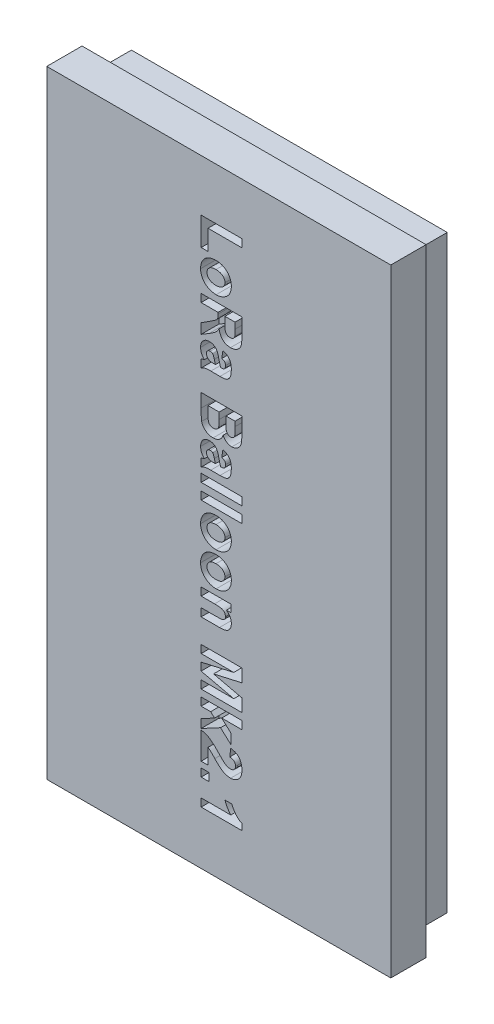
from build123d import *

# Parameters (mm, degrees)
SKETCH1_W   = 39
SKETCH1_H   = 70
BASE_DEPTH  = 4
SKETCH2_W   = 35.8
SKETCH2_H   = 66.8
SKETCH2_W_2 = 32.2
SKETCH2_H_2 = 63.2
MOUNT_DEPTH = 4
SKETCH3_W   = 0.900579279
SKETCH3_H   = 0.90057928
SKETCH3_W_2 = 4.622973633
SKETCH3_H_2 = 0.900579279
NAME_DEPTH  = 2


with BuildPart() as part:
    # Sketch1 → Base (new body)
    with BuildSketch(Plane.XY):
        with Locations((19.5, 35)):
            Rectangle(SKETCH1_W, SKETCH1_H)
    extrude(amount=BASE_DEPTH)

    # Sketch2 → Mount (add)
    with BuildSketch(Plane(origin=(0, 0, 0), x_dir=(-1, 0, 0), z_dir=(0, 0, -1))):
        with Locations((-19.5, 35)):
            Rectangle(SKETCH2_W, SKETCH2_H)
        with Locations((-19.5, 35)):
            Rectangle(SKETCH2_W_2, SKETCH2_H_2, mode=Mode.SUBTRACT)
    extrude(amount=MOUNT_DEPTH)

    # Sketch3 → Name (cut)
    # profile 1 of 16: a face of its own
    with BuildSketch(Plane.XY.offset(4)):
        with BuildLine():
            Line((17.5, 6.031366522), (17.5, 6.931945801))
            Line((17.5, 6.931945801), (20.862162642, 6.931945801))
            add(Edge.make_bspline(
                [(20.862162642, 6.931945801), (20.825420678, 6.973453861), (20.752187332, 7.056186897), (20.650809234, 7.187206769), (20.557100635, 7.322777322), (20.471558908, 7.463891787), (20.391697133, 7.608335094), (20.320234004, 7.758471363), (20.256125646, 7.91310561), (20.219928142, 8.019309163), (20.201737837, 8.072679554)],
                knots=[0, 0, 0, 0, 1.001509735, 1.996189151, 2.991510399, 3.978083136, 4.977007007, 5.972841423, 6.981293538, 8, 8, 8, 8], degree=3))
            Line((20.201737837, 8.072679554), (20.982239879, 8.072679554))
            add(Edge.make_bspline(
                [(20.982239879, 8.072679554), (21.005109125, 8.009636198), (21.052173734, 7.879893794), (21.148968325, 7.688624219), (21.269130809, 7.494509439), (21.384880743, 7.332887129), (21.488031291, 7.207004744), (21.569425456, 7.118590303), (21.654643351, 7.038363577), (21.742171402, 6.965389753), (21.83321772, 6.900070199), (21.926439738, 6.842109696), (22.022864157, 6.791460098), (22.089583646, 6.764422764), (22.122973633, 6.750891842)],
                knots=[0, 0, 0, 0, 1.342167567, 2.762163326, 4.283089962, 5.911699164, 6.739232247, 7.541374442, 8.316663201, 9.081638931, 9.82204544, 10.55892081, 11.278807199, 12, 12, 12, 12], degree=3))
            Line((22.122973633, 6.750891842), (22.122973633, 6.031366522))
            Line((22.122973633, 6.031366522), (17.5, 6.031366522))
        make_face()
    # profile 2 of 16: a face of its own
    with BuildSketch(Plane.XY.offset(4)):
        with Locations((17.950289639, 9.423548473)):
            Rectangle(SKETCH3_W, SKETCH3_H)
    # profile 3 of 16: a face of its own
    with BuildSketch(Plane.XY.offset(4)):
        with BuildLine():
            Line((18.280502042, 10.534262917), (17.5, 10.534262917))
            Line((17.5, 10.534262917), (17.5, 13.596232466))
            add(Edge.make_bspline(
                [(17.5, 13.596232466), (17.576949108, 13.585805601), (17.731103203, 13.564917198), (17.956960174, 13.50144426), (18.176976559, 13.413558777), (18.355748105, 13.319061126), (18.500491615, 13.226498924), (18.618013159, 13.142016572), (18.743992969, 13.043312165), (18.877122245, 12.928814113), (19.01967577, 12.800831624), (19.169263399, 12.656658807), (19.328268107, 12.499154665), (19.435248568, 12.387579437), (19.490655448, 12.329792855)],
                knots=[0, 0, 0, 0, 1.156489976, 2.316825642, 3.486320793, 4.683282346, 5.324698959, 6.046521303, 6.840115785, 7.709802379, 8.663715879, 9.695716306, 10.80657488, 12, 12, 12, 12], degree=3))
            add(Edge.make_bspline(
                [(19.490655448, 12.329792855), (19.534031724, 12.284677519), (19.616947467, 12.198437484), (19.736659107, 12.076728308), (19.8457136, 11.968753812), (19.942980669, 11.874007239), (20.029091873, 11.792707575), (20.105351076, 11.726417986), (20.169302387, 11.672159687), (20.210020272, 11.642893937), (20.228004733, 11.629967707)],
                knots=[0, 0, 0, 0, 1.475912402, 2.821274315, 4.025817635, 5.094889091, 6.023583783, 6.817889709, 7.477880126, 8, 8, 8, 8], degree=3))
            add(Edge.make_bspline(
                [(20.228004733, 11.629967707), (20.273808559, 11.600082147), (20.362500689, 11.542213313), (20.505070734, 11.481150256), (20.648064319, 11.442092349), (20.744350233, 11.437235769), (20.791804886, 11.434842196)],
                knots=[0, 0, 0, 0, 1.081757693, 2.094658972, 3.060949906, 4, 4, 4, 4], degree=3))
            add(Edge.make_bspline(
                [(20.791804886, 11.434842196), (20.839190464, 11.436345215), (20.929033186, 11.439194926), (21.054547391, 11.468228017), (21.162042796, 11.516383402), (21.250119658, 11.584209246), (21.318369668, 11.668283776), (21.367895285, 11.764693051), (21.397955403, 11.87335497), (21.400954099, 11.949662912), (21.40251021, 11.989261315)],
                knots=[0, 0, 0, 0, 1.215311032, 2.304221153, 3.285231831, 4.218502273, 5.131618139, 6.043921387, 6.984934089, 8, 8, 8, 8], degree=3))
            add(Edge.make_bspline(
                [(21.40251021, 11.989261315), (21.400764871, 12.032313466), (21.397439101, 12.11434999), (21.365944968, 12.229621644), (21.313665414, 12.329258262), (21.238787013, 12.412038323), (21.143533218, 12.478619319), (21.0275452, 12.527929185), (20.89161993, 12.561367794), (20.793877377, 12.57065489), (20.742085405, 12.57557595)],
                knots=[0, 0, 0, 0, 1.036204622, 1.974503585, 2.854824847, 3.725113167, 4.639232692, 5.635159131, 6.746914543, 8, 8, 8, 8], degree=3))
            Line((20.742085405, 12.57557595), (20.862162642, 13.476155229))
            add(Edge.make_bspline(
                [(20.862162642, 13.476155229), (20.914856848, 13.468924903), (21.017247203, 13.454875622), (21.164229292, 13.419446686), (21.300577042, 13.375788336), (21.426342918, 13.322550059), (21.540554019, 13.258218808), (21.644379225, 13.184749982), (21.738273215, 13.102054447), (21.819847944, 13.008347774), (21.891505772, 12.906292566), (21.953692359, 12.79596872), (22.0057178, 12.677623463), (22.049852168, 12.551778027), (22.081514616, 12.417328436), (22.106536559, 12.275228717), (22.120320981, 12.12493433), (22.122076294, 12.022120737), (22.122973633, 11.969561143)],
                knots=[0, 0, 0, 0, 1.162602182, 2.259057697, 3.301481224, 4.291058719, 5.240278367, 6.162482201, 7.068337645, 7.969664106, 8.872804886, 9.791477257, 10.734443434, 11.696874505, 12.703694303, 13.751554906, 14.850566762, 16, 16, 16, 16], degree=3))
            add(Edge.make_bspline(
                [(22.122973633, 11.969561143), (22.12216436, 11.911958212), (22.120593899, 11.80017506), (22.10070975, 11.638117668), (22.072004647, 11.486359857), (22.028214484, 11.346159334), (21.974171699, 11.215978856), (21.906051478, 11.097706108), (21.827160263, 10.989068519), (21.734640289, 10.894424656), (21.635492304, 10.810293791), (21.531834654, 10.737169245), (21.425852143, 10.673343767), (21.315019184, 10.622432795), (21.20055895, 10.583091186), (21.082762706, 10.554948562), (20.961508115, 10.537346514), (20.879421508, 10.535300855), (20.837771953, 10.534262917)],
                knots=[0, 0, 0, 0, 1.276022515, 2.476225004, 3.613980213, 4.694828494, 5.72599757, 6.731860776, 7.713356894, 8.693775576, 9.657589192, 10.592250898, 11.502803356, 12.395963178, 13.290278707, 14.181284388, 15.077210041, 16, 16, 16, 16], degree=3))
            add(Edge.make_bspline(
                [(20.837771953, 10.534262917), (20.790493163, 10.535236326), (20.696531434, 10.537170874), (20.556651025, 10.556121701), (20.418916098, 10.584936664), (20.282434953, 10.625329041), (20.14772348, 10.679930058), (20.012250121, 10.745399086), (19.877267542, 10.824863433), (19.764667283, 10.900724227), (19.671792871, 10.969915424), (19.596838962, 11.030770989), (19.518336525, 11.10098997), (19.433551797, 11.177527932), (19.344911187, 11.263130781), (19.250792263, 11.356025715), (19.152318029, 11.457407218), (19.085896671, 11.528535938), (19.05162305, 11.565238571)],
                knots=[0, 0, 0, 0, 1.065579015, 2.117728587, 3.177060151, 4.236743671, 5.322224058, 6.451217098, 7.626726301, 8.850986631, 9.510985169, 10.237811417, 11.027173618, 11.885690493, 12.813298488, 13.805522413, 14.867642961, 16, 16, 16, 16], degree=3))
            add(Edge.make_bspline(
                [(19.05162305, 11.565238571), (19.020079063, 11.599046391), (18.960015664, 11.663420389), (18.873550311, 11.754882826), (18.794668334, 11.835818348), (18.72567576, 11.908457691), (18.664320168, 11.970319157), (18.611893835, 12.023282507), (18.567294086, 12.065946194), (18.500825624, 12.127365663), (18.409279651, 12.203320651), (18.322081773, 12.25719707), (18.280502042, 12.282887684)],
                knots=[0, 0, 0, 0, 1.312344043, 2.498854831, 3.572154266, 4.519962786, 5.342095471, 6.044967059, 6.635010651, 7.093519002, 8.614063769, 10, 10, 10, 10], degree=3))
            Line((18.280502042, 12.282887684), (18.280502042, 10.534262917))
        make_face()
    # profile 4 of 16: a face of its own
    with BuildSketch(Plane.XY.offset(4)):
        Polygon((17.5, 16.838317871), (22.122973633, 16.838317871), (22.122973633, 15.937738592), (19.829310781, 15.937738592), (20.862162642, 14.999635176), (20.862162642, 13.86640625), (19.697976303, 14.922710696), (17.5, 13.746329013), (17.5, 14.715389841), (19.026294257, 15.532477916), (18.580695135, 15.937738592), (17.5, 15.937738592), align=None)
    # profile 5 of 16: a face of its own
    with BuildSketch(Plane.XY.offset(4)):
        Polygon((17.5, 22.001639071), (22.122973633, 22.001639071), (22.122973633, 20.538197743), (18.90903133, 19.810229492), (22.122973633, 19.06537538), (22.122973633, 17.618819913), (17.5, 17.618819913), (17.5, 18.519399192), (21.198941768, 18.519399192), (17.5, 19.378701921), (17.5, 20.261457235), (21.198941768, 21.101059792), (17.5, 21.101059792), align=None)
    # profile 6 of 16: a face of its own
    with BuildSketch(Plane.XY.offset(4)):
        with BuildLine():
            Line((17.5, 24.703376909), (17.5, 25.603956188))
            Line((17.5, 25.603956188), (19.218605458, 25.603956188))
            add(Edge.make_bspline(
                [(19.218605458, 25.603956188), (19.259881981, 25.604218431), (19.33868675, 25.604719103), (19.451598313, 25.606227025), (19.553850951, 25.610184029), (19.645484529, 25.614787512), (19.726240729, 25.620031047), (19.796064397, 25.627355164), (19.8548999, 25.636629558), (19.918206403, 25.649836461), (19.986420727, 25.672573643), (20.058026651, 25.710356309), (20.120869879, 25.756588033), (20.171139913, 25.813649771), (20.211805696, 25.876565918), (20.241236399, 25.944645495), (20.258624837, 26.017106197), (20.26071657, 26.066660636), (20.261776456, 26.091769964)],
                knots=[0, 0, 0, 0, 1.518468101, 2.899045743, 4.15374029, 5.282521764, 6.274203078, 7.130400985, 7.864176346, 8.464331223, 9.50833919, 10.496277288, 11.432641907, 12.361201578, 13.276990523, 14.178728215, 15.077158116, 16, 16, 16, 16], degree=3))
            add(Edge.make_bspline(
                [(20.261776456, 26.091769964), (20.260395831, 26.124432779), (20.257666872, 26.188994447), (20.234037383, 26.282658539), (20.197101841, 26.371978971), (20.144264328, 26.45430824), (20.080370598, 26.530343486), (20.001643315, 26.592223164), (19.913268019, 26.643887595), (19.829602888, 26.676153618), (19.752735925, 26.695237438), (19.683087132, 26.709741518), (19.601504403, 26.72009486), (19.508648449, 26.729871123), (19.404062142, 26.735525227), (19.288092488, 26.741809576), (19.160451233, 26.744093369), (19.071635516, 26.744485574), (19.025356154, 26.744689941)],
                knots=[0, 0, 0, 0, 0.987208667, 1.951327175, 2.905781144, 3.900987558, 4.900863378, 5.897104334, 6.91491578, 7.990576578, 8.596595857, 9.311207409, 10.142408639, 11.084155198, 12.136793968, 13.311756484, 14.59923223, 16, 16, 16, 16], degree=3))
            Line((19.025356154, 26.744689941), (17.5, 26.744689941))
            Line((17.5, 26.744689941), (17.5, 27.645269221))
            Line((17.5, 27.645269221), (20.862162642, 27.645269221))
            Line((20.862162642, 27.645269221), (20.862162642, 26.80472856))
            Line((20.862162642, 26.80472856), (20.369658349, 26.80472856))
            add(Edge.make_bspline(
                [(20.369658349, 26.80472856), (20.413616533, 26.770321373), (20.49957413, 26.703040178), (20.611985052, 26.588858325), (20.708270507, 26.468850505), (20.786728659, 26.341680594), (20.847225588, 26.20722185), (20.890517621, 26.066086122), (20.917784325, 25.918022166), (20.920714558, 25.816711582), (20.922201261, 25.765309975)],
                knots=[0, 0, 0, 0, 1.093461536, 2.13819855, 3.132977593, 4.104514142, 5.059389303, 6.015385568, 6.993072912, 8, 8, 8, 8], degree=3))
            add(Edge.make_bspline(
                [(20.922201261, 25.765309975), (20.920317919, 25.706700332), (20.91666388, 25.59298654), (20.885696808, 25.429335393), (20.832707603, 25.280159734), (20.760298213, 25.146629132), (20.672194055, 25.030041421), (20.570901367, 24.931660785), (20.456656392, 24.854076223), (20.352110831, 24.804673832), (20.260861224, 24.775259714), (20.185114665, 24.755547549), (20.101698698, 24.739757931), (20.011142966, 24.727221383), (19.913646699, 24.715475495), (19.808775892, 24.70812277), (19.696745732, 24.704905258), (19.619489692, 24.703895822), (19.579775273, 24.703376909)],
                knots=[0, 0, 0, 0, 1.428465185, 2.77149258, 4.042602701, 5.274402086, 6.460971935, 7.593531473, 8.701853732, 9.81394723, 10.399934156, 11.038034574, 11.721500487, 12.468854998, 13.267186475, 14.115831328, 15.031419898, 16, 16, 16, 16], degree=3))
            Line((19.579775273, 24.703376909), (17.5, 24.703376909))
        make_face()
    # profile 7 of 16: a face of its own
    with BuildSketch(Plane.XY.offset(4)):
        with BuildLine():
            add(Edge.make_bspline(
                [(19.227986492, 31.667856667), (19.268340591, 31.667036399), (19.348241235, 31.665412278), (19.466831788, 31.655463322), (19.582597294, 31.63605464), (19.695714536, 31.61096501), (19.806416527, 31.579441893), (19.913363069, 31.538151235), (20.018572563, 31.492044265), (20.119538873, 31.437034064), (20.216642118, 31.37772074), (20.307982668, 31.31296281), (20.392270804, 31.242988622), (20.471764649, 31.17048616), (20.542963196, 31.091302442), (20.610173753, 31.009624992), (20.668761487, 30.921545212), (20.722741328, 30.830764248), (20.769340893, 30.735441575), (20.810963092, 30.637695358), (20.84421655, 30.535984358), (20.874003462, 30.432726526), (20.895076066, 30.325606876), (20.911226693, 30.216077493), (20.920807626, 30.103272259), (20.921733394, 30.027131659), (20.922201261, 29.988651553)],
                knots=[0, 0, 0, 0, 1.087797627, 2.153826546, 3.204146119, 4.249074796, 5.276002369, 6.302929943, 7.33671768, 8.369955531, 9.399197913, 10.402506754, 11.384561342, 12.350717656, 13.299250364, 14.252266119, 15.199037181, 16.147307724, 17.097187567, 18.056740571, 19.008264324, 19.97962709, 20.951574749, 21.948063114, 22.962987564, 24, 24, 24, 24], degree=3))
            add(Edge.make_bspline(
                [(20.922201261, 29.988651553), (20.920492435, 29.924793493), (20.917163302, 29.800385279), (20.89380331, 29.618918473), (20.853287611, 29.448294563), (20.797267351, 29.287458199), (20.72326136, 29.137817172), (20.634810544, 28.997501786), (20.529143938, 28.868450261), (20.40795289, 28.752300781), (20.277240101, 28.647523356), (20.139130934, 28.556579151), (19.996080966, 28.47910388), (19.847473094, 28.415937377), (19.693540221, 28.365560189), (19.533372162, 28.331856616), (19.368435672, 28.308776132), (19.256523789, 28.306730224), (19.199843389, 28.305694025)],
                knots=[0, 0, 0, 0, 1.136040707, 2.213233445, 3.248238065, 4.25119704, 5.236487175, 6.211911138, 7.196384178, 8.195725979, 9.1931767, 10.173001403, 11.133846892, 12.083513917, 13.042376269, 14.010298635, 14.992269034, 16, 16, 16, 16], degree=3))
            add(Edge.make_bspline(
                [(19.199843389, 28.305694025), (19.157599655, 28.306375339), (19.0738988, 28.307725281), (18.949923499, 28.319708358), (18.828866965, 28.336918185), (18.710806659, 28.362715812), (18.595913097, 28.394995558), (18.484212787, 28.436018323), (18.375843769, 28.483701954), (18.270645012, 28.537857586), (18.171228883, 28.598868058), (18.076479739, 28.663312491), (17.989613644, 28.733981019), (17.908343846, 28.808413365), (17.833120613, 28.887136475), (17.764474284, 28.970880003), (17.702322369, 29.059272896), (17.647348245, 29.152054033), (17.598380596, 29.247901658), (17.556075444, 29.34662638), (17.52061437, 29.447625363), (17.49154767, 29.55076545), (17.4673821, 29.655801901), (17.452433072, 29.763820298), (17.441007522, 29.873647075), (17.440311587, 29.947656406), (17.439961381, 29.984899139)],
                knots=[0, 0, 0, 0, 1.117558833, 2.214307803, 3.293244786, 4.351421184, 5.409597582, 6.448807362, 7.497331125, 8.540978692, 9.576922014, 10.582241184, 11.570837346, 12.537122916, 13.496974449, 14.449450387, 15.399839374, 16.353464778, 17.300823134, 18.246083241, 19.193441597, 20.131138339, 21.080698472, 22.042616426, 23.015011865, 24, 24, 24, 24], degree=3))
            add(Edge.make_bspline(
                [(17.439961381, 29.984899139), (17.441434818, 30.04406421), (17.444329398, 30.160294537), (17.466190044, 30.33088657), (17.502637169, 30.493596014), (17.553836141, 30.648679353), (17.618260134, 30.796499008), (17.698440035, 30.936217507), (17.79447105, 31.067058897), (17.902499007, 31.190733435), (18.024251963, 31.303867806), (18.159878703, 31.401567068), (18.308067385, 31.483794972), (18.468125433, 31.551399101), (18.640780217, 31.603847691), (18.825794291, 31.641044136), (19.022910429, 31.66380433), (19.158504181, 31.666483685), (19.227986492, 31.667856667)],
                knots=[0, 0, 0, 0, 1.024594995, 2.012826322, 2.973358778, 3.908543225, 4.837401023, 5.761810751, 6.69243552, 7.644223827, 8.602462928, 9.564551743, 10.532007457, 11.531954493, 12.568505162, 13.651979317, 14.796803673, 16, 16, 16, 16], degree=3))
        make_face()
        with BuildLine():
            add(Edge.make_bspline(
                [(19.181081321, 30.767277388), (19.140418132, 30.7664685), (19.061457429, 30.764897782), (18.946509384, 30.755317355), (18.839622498, 30.735604285), (18.739486697, 30.712662461), (18.647961982, 30.678719777), (18.563118232, 30.640144076), (18.486368037, 30.592693862), (18.418159022, 30.538377324), (18.358227437, 30.478913691), (18.305063926, 30.416760149), (18.260023454, 30.351559232), (18.223835025, 30.282773737), (18.195763008, 30.211300883), (18.174765469, 30.136603171), (18.162389452, 30.058800558), (18.161082475, 30.005893388), (18.160424805, 29.979270519)],
                knots=[0, 0, 0, 0, 1.347985487, 2.617548842, 3.817114289, 4.948286482, 6.017057593, 7.046407217, 8.032969353, 8.999289909, 9.930051738, 10.827140183, 11.706817169, 12.550594062, 13.397420762, 14.247349517, 15.118066881, 16, 16, 16, 16], degree=3))
            add(Edge.make_bspline(
                [(18.160424805, 29.979270519), (18.161082172, 29.95327184), (18.162388524, 29.90160605), (18.174768649, 29.825667547), (18.195758212, 29.752830162), (18.224167513, 29.682614172), (18.260561859, 29.61498155), (18.306359128, 29.551083491), (18.359147439, 29.489568475), (18.42010437, 29.431777283), (18.488357165, 29.377647138), (18.565874129, 29.331881148), (18.650982245, 29.2934674), (18.743354127, 29.261692013), (18.843361939, 29.236148079), (18.951359004, 29.218739084), (19.067059726, 29.208514906), (19.146662829, 29.207035174), (19.187648045, 29.206273304)],
                knots=[0, 0, 0, 0, 0.86498205, 1.718932724, 2.552529207, 3.383717481, 4.236080589, 5.102502034, 5.995588818, 6.930639414, 7.894730959, 8.889086482, 9.918564038, 10.998334367, 12.1369617, 13.350269694, 14.635734454, 16, 16, 16, 16], degree=3))
            add(Edge.make_bspline(
                [(19.187648045, 29.206273304), (19.227688932, 29.207071515), (19.305407142, 29.208620818), (19.418448526, 29.21833585), (19.523973479, 29.237633658), (19.622320571, 29.262397561), (19.713524667, 29.294467861), (19.797316766, 29.333759882), (19.873991238, 29.380754838), (19.942107737, 29.435517195), (20.003044034, 29.494278407), (20.055828048, 29.556726541), (20.101619145, 29.621572383), (20.138009283, 29.690136473), (20.166408615, 29.761288764), (20.187393837, 29.83506114), (20.199774112, 29.911930299), (20.201080471, 29.964216902), (20.201737837, 29.99052776)],
                knots=[0, 0, 0, 0, 1.337232047, 2.595528913, 3.783536199, 4.915617704, 5.97906533, 7.006690339, 8.000659516, 8.974235141, 9.919454987, 10.823278711, 11.700968276, 12.565199868, 13.408680491, 14.254935835, 15.121875735, 16, 16, 16, 16], degree=3))
            add(Edge.make_bspline(
                [(20.201737837, 29.99052776), (20.201125638, 30.01684595), (20.199923414, 30.068529121), (20.187117275, 30.14469067), (20.1666105, 30.217653188), (20.137959369, 30.288106282), (20.10165055, 30.355793068), (20.055496899, 30.419705203), (20.003354012, 30.482079465), (19.942036507, 30.539894934), (19.873587127, 30.593986498), (19.796542842, 30.640468461), (19.712370979, 30.68027929), (19.620397249, 30.711967226), (19.521262796, 30.737162293), (19.414268616, 30.754931366), (19.300102491, 30.764983319), (19.221439565, 30.766499505), (19.181081321, 30.767277388)],
                knots=[0, 0, 0, 0, 0.8777483, 1.723705717, 2.56959874, 3.403036217, 4.257705828, 5.126471818, 6.029908573, 6.967489424, 7.934189811, 8.936630112, 9.963815147, 11.036651848, 12.178360317, 13.374360467, 14.652907978, 16, 16, 16, 16], degree=3))
        make_face(mode=Mode.SUBTRACT)
    # profile 8 of 16: a face of its own
    with BuildSketch(Plane.XY.offset(4)):
        with BuildLine():
            add(Edge.make_bspline(
                [(19.227986492, 35.510328258), (19.268340591, 35.50950799), (19.348241235, 35.507883869), (19.466831788, 35.497934913), (19.582597294, 35.478526231), (19.695714536, 35.453436601), (19.806416527, 35.421913484), (19.913363069, 35.380622826), (20.018572563, 35.334515856), (20.119538873, 35.279505655), (20.216642118, 35.22019233), (20.307982668, 35.155434401), (20.392270804, 35.085460213), (20.471764649, 35.012957751), (20.542963196, 34.933774033), (20.610173753, 34.852096583), (20.668761487, 34.764016803), (20.722741328, 34.673235839), (20.769340893, 34.577913166), (20.810963092, 34.480166949), (20.84421655, 34.378455949), (20.874003462, 34.275198117), (20.895076066, 34.168078467), (20.911226693, 34.058549084), (20.920807626, 33.945743849), (20.921733394, 33.86960325), (20.922201261, 33.831123144)],
                knots=[0, 0, 0, 0, 1.087797627, 2.153826546, 3.204146119, 4.249074796, 5.276002369, 6.302929943, 7.33671768, 8.369955531, 9.399197913, 10.402506754, 11.384561342, 12.350717656, 13.299250364, 14.252266119, 15.199037181, 16.147307724, 17.097187567, 18.056740571, 19.008264324, 19.97962709, 20.951574749, 21.948063114, 22.962987564, 24, 24, 24, 24], degree=3))
            add(Edge.make_bspline(
                [(20.922201261, 33.831123144), (20.920492435, 33.767265084), (20.917163302, 33.64285687), (20.89380331, 33.461390064), (20.853287611, 33.290766154), (20.797267351, 33.12992979), (20.72326136, 32.980288763), (20.634810544, 32.839973377), (20.529143938, 32.710921852), (20.40795289, 32.594772372), (20.277240101, 32.489994947), (20.139130934, 32.399050742), (19.996080966, 32.321575471), (19.847473094, 32.258408968), (19.693540221, 32.20803178), (19.533372162, 32.174328206), (19.368435672, 32.151247723), (19.256523789, 32.149201815), (19.199843389, 32.148165616)],
                knots=[0, 0, 0, 0, 1.136040707, 2.213233445, 3.248238065, 4.25119704, 5.236487175, 6.211911138, 7.196384178, 8.195725979, 9.1931767, 10.173001403, 11.133846892, 12.083513917, 13.042376269, 14.010298635, 14.992269034, 16, 16, 16, 16], degree=3))
            add(Edge.make_bspline(
                [(19.199843389, 32.148165616), (19.157599655, 32.14884693), (19.0738988, 32.150196872), (18.949923499, 32.162179949), (18.828866965, 32.179389776), (18.710806659, 32.205187403), (18.595913097, 32.237467149), (18.484212787, 32.278489913), (18.375843769, 32.326173545), (18.270645012, 32.380329177), (18.171228883, 32.441339649), (18.076479739, 32.505784082), (17.989613644, 32.57645261), (17.908343846, 32.650884955), (17.833120613, 32.729608066), (17.764474284, 32.813351594), (17.702322369, 32.901744487), (17.647348245, 32.994525624), (17.598380596, 33.090373249), (17.556075444, 33.189097971), (17.52061437, 33.290096954), (17.49154767, 33.393237041), (17.4673821, 33.498273492), (17.452433072, 33.606291889), (17.441007522, 33.716118666), (17.440311587, 33.790127997), (17.439961381, 33.82737073)],
                knots=[0, 0, 0, 0, 1.117558833, 2.214307803, 3.293244786, 4.351421184, 5.409597582, 6.448807362, 7.497331125, 8.540978692, 9.576922014, 10.582241184, 11.570837346, 12.537122916, 13.496974449, 14.449450387, 15.399839374, 16.353464778, 17.300823134, 18.246083241, 19.193441597, 20.131138339, 21.080698472, 22.042616426, 23.015011865, 24, 24, 24, 24], degree=3))
            add(Edge.make_bspline(
                [(17.439961381, 33.82737073), (17.441434818, 33.886535801), (17.444329398, 34.002766128), (17.466190044, 34.173358161), (17.502637169, 34.336067605), (17.553836141, 34.491150944), (17.618260134, 34.638970598), (17.698440035, 34.778689098), (17.79447105, 34.909530488), (17.902499007, 35.033205026), (18.024251963, 35.146339397), (18.159878703, 35.244038659), (18.308067385, 35.326266563), (18.468125433, 35.393870691), (18.640780217, 35.446319282), (18.825794291, 35.483515727), (19.022910429, 35.506275921), (19.158504181, 35.508955276), (19.227986492, 35.510328258)],
                knots=[0, 0, 0, 0, 1.024594995, 2.012826322, 2.973358778, 3.908543225, 4.837401023, 5.761810751, 6.69243552, 7.644223827, 8.602462928, 9.564551743, 10.532007457, 11.531954493, 12.568505162, 13.651979317, 14.796803673, 16, 16, 16, 16], degree=3))
        make_face()
        with BuildLine():
            add(Edge.make_bspline(
                [(19.181081321, 34.609748979), (19.140418132, 34.608940091), (19.061457429, 34.607369372), (18.946509384, 34.597788946), (18.839622498, 34.578075876), (18.739486697, 34.555134052), (18.647961982, 34.521191368), (18.563118232, 34.482615667), (18.486368037, 34.435165452), (18.418159022, 34.380848915), (18.358227437, 34.321385282), (18.305063926, 34.25923174), (18.260023454, 34.194030823), (18.223835025, 34.125245328), (18.195763008, 34.053772474), (18.174765469, 33.979074761), (18.162389452, 33.901272149), (18.161082475, 33.848364979), (18.160424805, 33.82174211)],
                knots=[0, 0, 0, 0, 1.347985487, 2.617548842, 3.817114289, 4.948286482, 6.017057593, 7.046407217, 8.032969353, 8.999289909, 9.930051738, 10.827140183, 11.706817169, 12.550594062, 13.397420762, 14.247349517, 15.118066881, 16, 16, 16, 16], degree=3))
            add(Edge.make_bspline(
                [(18.160424805, 33.82174211), (18.161082172, 33.795743431), (18.162388524, 33.744077641), (18.174768649, 33.668139138), (18.195758212, 33.595301753), (18.224167513, 33.525085763), (18.260561859, 33.457453141), (18.306359128, 33.393555082), (18.359147439, 33.332040066), (18.42010437, 33.274248873), (18.488357165, 33.220118729), (18.565874129, 33.174352739), (18.650982245, 33.135938991), (18.743354127, 33.104163604), (18.843361939, 33.07861967), (18.951359004, 33.061210674), (19.067059726, 33.050986497), (19.146662829, 33.049506765), (19.187648045, 33.048744895)],
                knots=[0, 0, 0, 0, 0.86498205, 1.718932724, 2.552529207, 3.383717481, 4.236080589, 5.102502034, 5.995588818, 6.930639414, 7.894730959, 8.889086482, 9.918564038, 10.998334367, 12.1369617, 13.350269694, 14.635734454, 16, 16, 16, 16], degree=3))
            add(Edge.make_bspline(
                [(19.187648045, 33.048744895), (19.227688932, 33.049543106), (19.305407142, 33.051092409), (19.418448526, 33.060807441), (19.523973479, 33.080105249), (19.622320571, 33.104869152), (19.713524667, 33.136939452), (19.797316766, 33.176231473), (19.873991238, 33.223226429), (19.942107737, 33.277988786), (20.003044034, 33.336749998), (20.055828048, 33.399198132), (20.101619145, 33.464043973), (20.138009283, 33.532608064), (20.166408615, 33.603760355), (20.187393837, 33.677532731), (20.199774112, 33.75440189), (20.201080471, 33.806688493), (20.201737837, 33.832999351)],
                knots=[0, 0, 0, 0, 1.337232047, 2.595528913, 3.783536199, 4.915617704, 5.97906533, 7.006690339, 8.000659516, 8.974235141, 9.919454987, 10.823278711, 11.700968276, 12.565199868, 13.408680491, 14.254935835, 15.121875735, 16, 16, 16, 16], degree=3))
            add(Edge.make_bspline(
                [(20.201737837, 33.832999351), (20.201125638, 33.859317541), (20.199923414, 33.911000712), (20.187117275, 33.987162261), (20.1666105, 34.060124779), (20.137959369, 34.130577873), (20.10165055, 34.198264659), (20.055496899, 34.262176794), (20.003354012, 34.324551056), (19.942036507, 34.382366525), (19.873587127, 34.436458089), (19.796542842, 34.482940052), (19.712370979, 34.522750881), (19.620397249, 34.554438817), (19.521262796, 34.579633884), (19.414268616, 34.597402957), (19.300102491, 34.60745491), (19.221439565, 34.608971096), (19.181081321, 34.609748979)],
                knots=[0, 0, 0, 0, 0.8777483, 1.723705717, 2.56959874, 3.403036217, 4.257705828, 5.126471818, 6.029908573, 6.967489424, 7.934189811, 8.936630112, 9.963815147, 11.036651848, 12.178360317, 13.374360467, 14.652907978, 16, 16, 16, 16], degree=3))
        make_face(mode=Mode.SUBTRACT)
    # profile 9 of 16: a face of its own
    with BuildSketch(Plane.XY.offset(4)):
        with Locations((19.811486817, 36.621042703)):
            Rectangle(SKETCH3_W_2, SKETCH3_H_2)
    # profile 10 of 16: a face of its own
    with BuildSketch(Plane.XY.offset(4)):
        with Locations((19.811486817, 38.362162642)):
            Rectangle(SKETCH3_W_2, SKETCH3_H)
    # profile 11 of 16: a face of its own
    with BuildSketch(Plane.XY.offset(4)):
        with BuildLine():
            Line((19.841506126, 41.514190119), (19.961583363, 42.354730779))
            add(Edge.make_bspline(
                [(19.961583363, 42.354730779), (20.003056427, 42.342822179), (20.08373433, 42.319656279), (20.198162111, 42.275938335), (20.30438426, 42.228511596), (20.401073835, 42.173704259), (20.489620864, 42.114291351), (20.568113139, 42.04778228), (20.637964286, 41.976247779), (20.699606916, 41.898815948), (20.752828321, 41.813756771), (20.798705368, 41.720744549), (20.837141958, 41.618910851), (20.867740873, 41.508588649), (20.892075182, 41.389790884), (20.909807303, 41.262288114), (20.919932697, 41.125979697), (20.921430674, 41.032334458), (20.922201261, 40.984161689)],
                knots=[0, 0, 0, 0, 1.125515524, 2.189474865, 3.193709533, 4.158305409, 5.086274303, 5.972285183, 6.837881566, 7.691743787, 8.549806887, 9.451203831, 10.393874208, 11.385866739, 12.435713252, 13.556277782, 14.742906037, 16, 16, 16, 16], degree=3))
            add(Edge.make_bspline(
                [(20.922201261, 40.984161689), (20.921986052, 40.941308612), (20.921567926, 40.858049768), (20.914195236, 40.737032314), (20.905701633, 40.623632526), (20.891648419, 40.518072692), (20.872802431, 40.420437543), (20.850656262, 40.330428478), (20.824366297, 40.248284068), (20.785361186, 40.151390147), (20.72686919, 40.044591849), (20.645227411, 39.932595052), (20.550150903, 39.841460018), (20.460504459, 39.780205056), (20.378336951, 39.742361729), (20.305144759, 39.718802341), (20.220833774, 39.698070589), (20.12519058, 39.681662166), (20.01811083, 39.668705222), (19.899799318, 39.659583899), (19.770265296, 39.653953559), (19.680158536, 39.653321832), (19.633247167, 39.652992942)],
                knots=[0, 0, 0, 0, 1.172645795, 2.278322549, 3.317437237, 4.284552983, 5.190951134, 6.037858116, 6.820064311, 7.549551753, 8.893788561, 10.141635195, 11.328036199, 12.481663495, 13.094362176, 13.79803918, 14.582676335, 15.469136844, 16.45214095, 17.533908717, 18.716103928, 20, 20, 20, 20], degree=3))
            Line((19.633247167, 39.652992942), (18.599457203, 39.660497769))
            add(Edge.make_bspline(
                [(18.599457203, 39.660497769), (18.564435728, 39.660205788), (18.496576972, 39.659640035), (18.398330909, 39.658483265), (18.307040045, 39.653276812), (18.222621106, 39.647594933), (18.144878475, 39.641908735), (18.074326469, 39.631817777), (18.010639761, 39.622171991), (17.934153527, 39.605482237), (17.841504636, 39.577679009), (17.729923806, 39.534274983), (17.614669352, 39.479704593), (17.539082625, 39.435628373), (17.5, 39.412838468)],
                knots=[0, 0, 0, 0, 1.100960395, 2.13325684, 3.08799504, 3.974623839, 4.793377983, 5.537123068, 6.214225653, 6.817686965, 7.996461938, 9.250537039, 10.578371695, 12, 12, 12, 12], degree=3))
            Line((17.5, 39.412838468), (17.5, 40.313417747))
            Line((17.5, 40.313417747), (17.867736539, 40.423175846))
            add(Edge.make_bspline(
                [(17.867736539, 40.423175846), (17.83226304, 40.45939334), (17.763238807, 40.529865237), (17.674416477, 40.644972922), (17.599695505, 40.763146591), (17.540260444, 40.886002381), (17.494849843, 41.012800628), (17.463178517, 41.143313177), (17.443827041, 41.277834702), (17.441261018, 41.368719791), (17.439961381, 41.414751157)],
                knots=[0, 0, 0, 0, 1.094238684, 2.129166538, 3.133671034, 4.10942336, 5.070833053, 6.037377746, 7.005973528, 8, 8, 8, 8], degree=3))
            add(Edge.make_bspline(
                [(17.439961381, 41.414751157), (17.441007341, 41.452615094), (17.443061457, 41.526974436), (17.454903777, 41.636008247), (17.476538098, 41.739623758), (17.507054288, 41.837634891), (17.543951561, 41.931232993), (17.591661801, 42.018833627), (17.646964549, 42.10164001), (17.71053094, 42.178636515), (17.781922723, 42.247322475), (17.857738316, 42.309714251), (17.941277911, 42.359576677), (18.028844016, 42.40317387), (18.123266364, 42.434066264), (18.222597532, 42.458105194), (18.327631273, 42.472178413), (18.399600412, 42.473921114), (18.436227209, 42.474808017)],
                knots=[0, 0, 0, 0, 1.111028414, 2.181900458, 3.212888925, 4.21115239, 5.190734394, 6.159429897, 7.131421471, 8.108723925, 9.081883785, 10.034678926, 10.981892532, 11.929727932, 12.898727489, 13.888948844, 14.925636122, 16, 16, 16, 16], degree=3))
            add(Edge.make_bspline(
                [(18.436227209, 42.474808017), (18.482593242, 42.473372815), (18.572724924, 42.470582904), (18.703283791, 42.448793498), (18.824622959, 42.412391226), (18.936022841, 42.360139981), (19.037479655, 42.295376718), (19.129142785, 42.218524625), (19.208842276, 42.128547659), (19.267148448, 42.044124803), (19.309753926, 41.96862461), (19.338835724, 41.902402774), (19.369441505, 41.829644903), (19.396985309, 41.748124366), (19.425368881, 41.659150164), (19.452494502, 41.56188663), (19.4774731, 41.456230244), (19.493569489, 41.383190178), (19.501912689, 41.345331504)],
                knots=[0, 0, 0, 0, 1.294162278, 2.515743014, 3.684113667, 4.820865117, 5.939906549, 7.036651616, 8.149715676, 9.285662014, 9.895437351, 10.567486448, 11.303637924, 12.098932185, 12.968810962, 13.91153998, 14.917493754, 16, 16, 16, 16], degree=3))
            add(Edge.make_bspline(
                [(19.501912689, 41.345331504), (19.511407002, 41.29963326), (19.529650374, 41.211823847), (19.559131352, 41.085951379), (19.587017816, 40.970804952), (19.61413993, 40.866238728), (19.640930358, 40.772559678), (19.668501435, 40.689876759), (19.694085633, 40.617635872), (19.712787099, 40.57381943), (19.721428888, 40.553572221)],
                knots=[0, 0, 0, 0, 1.361164628, 2.615484881, 3.770095419, 4.816364149, 5.765912261, 6.610903979, 7.358110453, 8, 8, 8, 8], degree=3))
            add(Edge.make_bspline(
                [(19.721428888, 40.553572221), (19.76207844, 40.554231496), (19.835936364, 40.55542936), (19.93546068, 40.560763475), (20.012171286, 40.572303879), (20.070146149, 40.58844442), (20.113156329, 40.61503175), (20.150196809, 40.646884119), (20.18179134, 40.688294767), (20.210776693, 40.737003838), (20.234039299, 40.795757876), (20.250744994, 40.864838443), (20.259418855, 40.94454444), (20.260957962, 41.001028678), (20.261776456, 41.03106686)],
                knots=[0, 0, 0, 0, 1.704637254, 3.09722893, 4.172654963, 4.956246112, 5.596985007, 6.275246559, 6.99385986, 7.769515704, 8.645866914, 9.631493719, 10.740434052, 12, 12, 12, 12], degree=3))
            add(Edge.make_bspline(
                [(20.261776456, 41.03106686), (20.260884607, 41.061819135), (20.25919465, 41.120091345), (20.241526382, 41.202176529), (20.215410217, 41.274928832), (20.174002857, 41.337526849), (20.117664666, 41.392371274), (20.042764104, 41.439724199), (19.949087652, 41.481595463), (19.879011929, 41.502826748), (19.841506126, 41.514190119)],
                knots=[0, 0, 0, 0, 1.045871977, 1.981813381, 2.848317391, 3.663751395, 4.514929533, 5.507645304, 6.666046366, 8, 8, 8, 8], degree=3))
        make_face()
        with BuildLine():
            add(Edge.make_bspline(
                [(19.121042702, 40.553572221), (19.111478433, 40.581029413), (19.090198568, 40.642119846), (19.059474829, 40.744742381), (19.027018533, 40.867855942), (19.005193715, 40.956919288), (18.993460638, 41.004799964)],
                knots=[0, 0, 0, 0, 0.743632693, 1.654533494, 2.73907137, 4, 4, 4, 4], degree=3))
            add(Edge.make_bspline(
                [(18.993460638, 41.004799964), (18.98653897, 41.033017956), (18.97332241, 41.08689873), (18.950053418, 41.163232813), (18.928514853, 41.232519981), (18.904326783, 41.293793407), (18.881777826, 41.348222317), (18.857166421, 41.394601166), (18.832210074, 41.433424727), (18.813567384, 41.455259472), (18.804901851, 41.465408741)],
                knots=[0, 0, 0, 0, 1.388607462, 2.65147299, 3.814389992, 4.855436495, 5.799565367, 6.62877246, 7.362623276, 8, 8, 8, 8], degree=3))
            add(Edge.make_bspline(
                [(18.804901851, 41.465408741), (18.787150786, 41.482293284), (18.752087496, 41.515644953), (18.686643373, 41.549529351), (18.614581201, 41.571002361), (18.563658271, 41.573135007), (18.537542378, 41.574228738)],
                knots=[0, 0, 0, 0, 0.985740837, 1.947112291, 2.947173789, 4, 4, 4, 4], degree=3))
            add(Edge.make_bspline(
                [(18.537542378, 41.574228738), (18.50766342, 41.572939924), (18.449801672, 41.570444088), (18.366786442, 41.546484186), (18.290760217, 41.50914416), (18.224593068, 41.455951695), (18.168585191, 41.393231307), (18.129814521, 41.31928554), (18.103890852, 41.238862588), (18.101569181, 41.18199624), (18.100386186, 41.153020304)],
                knots=[0, 0, 0, 0, 1.056198986, 2.045369905, 3.036276429, 4.038084886, 5.035473036, 5.992159802, 6.976916006, 8, 8, 8, 8], degree=3))
            add(Edge.make_bspline(
                [(18.100386186, 41.153020304), (18.101736527, 41.126025569), (18.104453435, 41.071711719), (18.124157539, 40.990656531), (18.156784545, 40.910533962), (18.200051148, 40.832286446), (18.252073425, 40.760421569), (18.311090427, 40.699433639), (18.374225547, 40.649895191), (18.432190619, 40.617965881), (18.484079963, 40.599086358), (18.530121172, 40.587625835), (18.5827991, 40.575734161), (18.642798398, 40.568047983), (18.709733915, 40.561359924), (18.78390109, 40.556870895), (18.865230729, 40.554055933), (18.921849407, 40.553737535), (18.951245984, 40.553572221)],
                knots=[0, 0, 0, 0, 1.093500888, 2.200141778, 3.360346716, 4.591280596, 5.815607582, 6.94487563, 8.019710678, 9.057444999, 9.610729159, 10.253199895, 10.979011171, 11.798077413, 12.702238226, 13.705425431, 14.808650418, 16, 16, 16, 16], degree=3))
            Line((18.951245984, 40.553572221), (19.121042702, 40.553572221))
        make_face(mode=Mode.SUBTRACT)
    # profile 12 of 16: a face of its own
    with BuildSketch(Plane.XY.offset(4)):
        with BuildLine():
            Line((22.122973633, 46.737549938), (22.122973633, 44.910124484))
            add(Edge.make_bspline(
                [(22.122973633, 44.910124484), (22.122521051, 44.850084862), (22.121651102, 44.734677139), (22.117632998, 44.568221255), (22.108005759, 44.415905539), (22.095757541, 44.277353061), (22.081840746, 44.152540778), (22.061533426, 44.041599191), (22.040180572, 43.944097754), (22.0049456, 43.833595711), (21.948462842, 43.709246881), (21.859088002, 43.573885608), (21.748544411, 43.450302277), (21.640427701, 43.359753677), (21.545807025, 43.29495681), (21.471963858, 43.251349674), (21.394724771, 43.215890036), (21.315529677, 43.187009152), (21.2346417, 43.162652812), (21.150572045, 43.147614693), (21.064475175, 43.136283422), (21.006044505, 43.135584759), (20.976611259, 43.135232821)],
                knots=[0, 0, 0, 0, 1.498327689, 2.88007457, 4.154414764, 5.305986542, 6.351317343, 7.286582663, 8.11946184, 8.840080679, 10.177555878, 11.512935148, 12.872513647, 14.301275782, 15.019863751, 15.733221227, 16.438466007, 17.137161526, 17.836031326, 18.543086972, 19.26611006, 20, 20, 20, 20], degree=3))
            add(Edge.make_bspline(
                [(20.976611259, 43.135232821), (20.922946761, 43.137303044), (20.817024149, 43.141389234), (20.662821857, 43.176710702), (20.51596526, 43.232138074), (20.380113254, 43.311328688), (20.256588311, 43.407542998), (20.148778926, 43.518348036), (20.056681459, 43.641777128), (20.011500867, 43.733566768), (19.988788362, 43.779709868)],
                knots=[0, 0, 0, 0, 1.031817477, 2.036594177, 3.029254201, 4.043130586, 5.050931669, 6.034203586, 7.01178454, 8, 8, 8, 8], degree=3))
            add(Edge.make_bspline(
                [(19.988788362, 43.779709868), (19.978291223, 43.748276354), (19.957542489, 43.686144606), (19.919057509, 43.596987521), (19.874445181, 43.513373813), (19.826159834, 43.433822513), (19.770442173, 43.360917896), (19.709973461, 43.293161392), (19.645321829, 43.229379638), (19.573797837, 43.173095387), (19.499063042, 43.120637644), (19.418797393, 43.076896374), (19.335071516, 43.039243904), (19.247401209, 43.00781132), (19.155229507, 42.984808535), (19.059306459, 42.967942303), (18.959608937, 42.957391697), (18.891858621, 42.95588334), (18.857435643, 42.955116966)],
                knots=[0, 0, 0, 0, 1.053917501, 2.08318216, 3.084375989, 4.067115349, 5.039987852, 5.998256831, 6.954975631, 7.924383767, 8.890110205, 9.856297623, 10.826929889, 11.808561028, 12.814635272, 13.844956918, 14.905053061, 16, 16, 16, 16], degree=3))
            add(Edge.make_bspline(
                [(18.857435643, 42.955116966), (18.815500063, 42.956062077), (18.733295748, 42.957914735), (18.612472135, 42.971178049), (18.496620731, 42.993557639), (18.385911071, 43.025581587), (18.279951486, 43.065972101), (18.179119697, 43.115922872), (18.083315073, 43.175373566), (17.992730779, 43.242648072), (17.90919217, 43.316006825), (17.833589227, 43.393712653), (17.765489185, 43.473928008), (17.707581308, 43.559131829), (17.656528591, 43.646316505), (17.61374927, 43.736794735), (17.581005615, 43.831050671), (17.565164633, 43.895583163), (17.557224308, 43.927930208)],
                knots=[0, 0, 0, 0, 1.145607172, 2.24567906, 3.316329682, 4.365460088, 5.390414304, 6.410550385, 7.434792233, 8.46684308, 9.489944109, 10.468671886, 11.426900475, 12.36059261, 13.279351643, 14.185149476, 15.09030244, 16, 16, 16, 16], degree=3))
            add(Edge.make_bspline(
                [(17.557224308, 43.927930208), (17.552629506, 43.954476266), (17.542179673, 44.014849236), (17.530238938, 44.117507113), (17.521967062, 44.242764847), (17.512784829, 44.390627107), (17.508239794, 44.561140115), (17.503113461, 44.754373132), (17.500511164, 44.970156543), (17.500175925, 45.12151011), (17.5, 45.200936543)],
                knots=[0, 0, 0, 0, 0.506837559, 1.152686718, 1.943271314, 2.868501158, 3.939884368, 5.152247396, 6.505573166, 8, 8, 8, 8], degree=3))
            Line((17.5, 45.200936543), (17.5, 46.737549938))
            Line((17.5, 46.737549938), (22.122973633, 46.737549938))
        make_face()
        with BuildLine():
            Line((21.342471591, 45.836970659), (20.321815075, 45.836970659))
            Line((20.321815075, 45.836970659), (20.321815075, 45.223451025))
            add(Edge.make_bspline(
                [(20.321815075, 45.223451025), (20.321708304, 45.179672293), (20.321505436, 45.096491461), (20.322860414, 44.97829506), (20.323271951, 44.873214079), (20.325612076, 44.7812947), (20.326868369, 44.702771579), (20.330184865, 44.637450258), (20.332255296, 44.585143819), (20.33545221, 44.554574189), (20.336824729, 44.541449842)],
                knots=[0, 0, 0, 0, 1.539755574, 2.925579234, 4.157432792, 5.235486124, 6.159601295, 6.919197766, 7.535983151, 8, 8, 8, 8], degree=3))
            add(Edge.make_bspline(
                [(20.336824729, 44.541449842), (20.342990913, 44.503699738), (20.354742688, 44.431753986), (20.388025395, 44.330904457), (20.433788831, 44.243241231), (20.491801151, 44.16799627), (20.562445267, 44.108032512), (20.646094328, 44.066032847), (20.740542137, 44.040045927), (20.807575483, 44.037261325), (20.84246247, 44.0358121)],
                knots=[0, 0, 0, 0, 1.156043088, 2.203236031, 3.197816213, 4.134692963, 5.061434266, 5.975433912, 6.946330216, 8, 8, 8, 8], degree=3))
            add(Edge.make_bspline(
                [(20.84246247, 44.0358121), (20.873876263, 44.036823866), (20.934019538, 44.038760942), (21.019351721, 44.060444709), (21.096016804, 44.093937475), (21.161935885, 44.14262246), (21.216357618, 44.200808188), (21.262093272, 44.264229102), (21.293723027, 44.334602435), (21.3117268, 44.399634222), (21.321477076, 44.463035926), (21.325841476, 44.52924141), (21.332380205, 44.613587703), (21.334869957, 44.715945723), (21.339580253, 44.836603876), (21.340377663, 44.975171632), (21.343094236, 45.131820783), (21.342686451, 45.242211346), (21.342471591, 45.300375505)],
                knots=[0, 0, 0, 0, 0.973031789, 1.862917975, 2.714444411, 3.555113712, 4.385861934, 5.180259999, 5.970734499, 6.766732084, 7.267820327, 7.959442945, 8.825288207, 9.893716152, 11.136763095, 12.573466007, 14.194578749, 16, 16, 16, 16], degree=3))
            Line((21.342471591, 45.300375505), (21.342471591, 45.836970659))
        make_face(mode=Mode.SUBTRACT)
        with BuildLine():
            Line((19.541313033, 45.836970659), (18.280502042, 45.836970659))
            Line((18.280502042, 45.836970659), (18.280502042, 44.996429998))
            add(Edge.make_bspline(
                [(18.280502042, 44.996429998), (18.280760428, 44.952339078), (18.281253401, 44.868218478), (18.282800025, 44.748429793), (18.286518536, 44.641150033), (18.291887116, 44.546029751), (18.299557696, 44.463184684), (18.307251331, 44.392614738), (18.317857629, 44.334782943), (18.331738252, 44.274037716), (18.35944942, 44.209130231), (18.402845831, 44.13923486), (18.458232543, 44.075216926), (18.525607831, 44.019335274), (18.604204685, 43.972817602), (18.693207476, 43.938929753), (18.79246554, 43.919124447), (18.861720576, 43.916895324), (18.897774089, 43.915734863)],
                knots=[0, 0, 0, 0, 1.468823539, 2.802352852, 3.990613231, 5.044577628, 5.97542194, 6.762296442, 7.407977832, 7.933490854, 8.834961323, 9.742609811, 10.665728169, 11.642033707, 12.646065455, 13.694610711, 14.799836276, 16, 16, 16, 16], degree=3))
            add(Edge.make_bspline(
                [(18.897774089, 43.915734863), (18.93476601, 43.917230815), (19.005924698, 43.92010847), (19.107872413, 43.940522207), (19.199388257, 43.976442803), (19.279963622, 44.026964865), (19.349625379, 44.088966591), (19.407243483, 44.161368569), (19.454309014, 44.242268996), (19.482516024, 44.31872795), (19.49973763, 44.38934175), (19.510234486, 44.455291191), (19.521102124, 44.533072283), (19.527554048, 44.623651319), (19.534829997, 44.726159136), (19.5376358, 44.84132482), (19.540957195, 44.968580629), (19.541190876, 45.057716133), (19.541313033, 45.104311891)],
                knots=[0, 0, 0, 0, 1.143215143, 2.19912046, 3.197116365, 4.165365694, 5.123819291, 6.065802965, 7.014162653, 8.005206416, 8.5725482, 9.259043701, 10.068343003, 10.999502645, 12.064921609, 13.244816419, 14.559722402, 16, 16, 16, 16], degree=3))
            Line((19.541313033, 45.104311891), (19.541313033, 45.836970659))
        make_face(mode=Mode.SUBTRACT)
    # profile 13 of 16: a face of its own
    with BuildSketch(Plane.XY.offset(4)):
        with BuildLine():
            Line((19.841506126, 51.240446333), (19.961583363, 52.080986994))
            add(Edge.make_bspline(
                [(19.961583363, 52.080986994), (20.003056427, 52.069078394), (20.08373433, 52.045912494), (20.198162111, 52.002194549), (20.30438426, 51.95476781), (20.401073835, 51.899960474), (20.489620864, 51.840547565), (20.568113139, 51.774038494), (20.637964286, 51.702503993), (20.699606916, 51.625072163), (20.752828321, 51.540012986), (20.798705368, 51.447000764), (20.837141958, 51.345167065), (20.867740873, 51.234844863), (20.892075182, 51.116047099), (20.909807303, 50.988544328), (20.919932697, 50.852235912), (20.921430674, 50.758590672), (20.922201261, 50.710417904)],
                knots=[0, 0, 0, 0, 1.125515524, 2.189474865, 3.193709533, 4.158305409, 5.086274303, 5.972285183, 6.837881566, 7.691743787, 8.549806887, 9.451203831, 10.393874208, 11.385866739, 12.435713252, 13.556277782, 14.742906037, 16, 16, 16, 16], degree=3))
            add(Edge.make_bspline(
                [(20.922201261, 50.710417904), (20.921986052, 50.667564826), (20.921567926, 50.584305983), (20.914195236, 50.463288529), (20.905701633, 50.34988874), (20.891648419, 50.244328906), (20.872802431, 50.146693758), (20.850656262, 50.056684693), (20.824366297, 49.974540283), (20.785361186, 49.877646362), (20.72686919, 49.770848064), (20.645227411, 49.658851266), (20.550150903, 49.567716233), (20.460504459, 49.50646127), (20.378336951, 49.468617943), (20.305144759, 49.445058555), (20.220833774, 49.424326803), (20.12519058, 49.407918381), (20.01811083, 49.394961437), (19.899799318, 49.385840114), (19.770265296, 49.380209773), (19.680158536, 49.379578046), (19.633247167, 49.379249157)],
                knots=[0, 0, 0, 0, 1.172645795, 2.278322549, 3.317437237, 4.284552983, 5.190951134, 6.037858116, 6.820064311, 7.549551753, 8.893788561, 10.141635195, 11.328036199, 12.481663495, 13.094362176, 13.79803918, 14.582676335, 15.469136844, 16.45214095, 17.533908717, 18.716103928, 20, 20, 20, 20], degree=3))
            Line((19.633247167, 49.379249157), (18.599457203, 49.386753984))
            add(Edge.make_bspline(
                [(18.599457203, 49.386753984), (18.564435728, 49.386462002), (18.496576972, 49.385896249), (18.398330909, 49.384739479), (18.307040045, 49.379533026), (18.222621106, 49.373851148), (18.144878475, 49.36816495), (18.074326469, 49.358073992), (18.010639761, 49.348428206), (17.934153527, 49.331738451), (17.841504636, 49.303935223), (17.729923806, 49.260531198), (17.614669352, 49.205960808), (17.539082625, 49.161884588), (17.5, 49.139094682)],
                knots=[0, 0, 0, 0, 1.100960395, 2.13325684, 3.08799504, 3.974623839, 4.793377983, 5.537123068, 6.214225653, 6.817686965, 7.996461938, 9.250537039, 10.578371695, 12, 12, 12, 12], degree=3))
            Line((17.5, 49.139094682), (17.5, 50.039673961))
            Line((17.5, 50.039673961), (17.867736539, 50.149432061))
            add(Edge.make_bspline(
                [(17.867736539, 50.149432061), (17.83226304, 50.185649555), (17.763238807, 50.256121451), (17.674416477, 50.371229137), (17.599695505, 50.489402805), (17.540260444, 50.612258595), (17.494849843, 50.739056843), (17.463178517, 50.869569391), (17.443827041, 51.004090916), (17.441261018, 51.094976005), (17.439961381, 51.141007371)],
                knots=[0, 0, 0, 0, 1.094238684, 2.129166538, 3.133671034, 4.10942336, 5.070833053, 6.037377746, 7.005973528, 8, 8, 8, 8], degree=3))
            add(Edge.make_bspline(
                [(17.439961381, 51.141007371), (17.441007341, 51.178871308), (17.443061457, 51.25323065), (17.454903777, 51.362264462), (17.476538098, 51.465879972), (17.507054288, 51.563891106), (17.543951561, 51.657489207), (17.591661801, 51.745089841), (17.646964549, 51.827896224), (17.71053094, 51.90489273), (17.781922723, 51.97357869), (17.857738316, 52.035970466), (17.941277911, 52.085832892), (18.028844016, 52.129430085), (18.123266364, 52.160322478), (18.222597532, 52.184361408), (18.327631273, 52.198434627), (18.399600412, 52.200177329), (18.436227209, 52.201064231)],
                knots=[0, 0, 0, 0, 1.111028414, 2.181900458, 3.212888925, 4.21115239, 5.190734394, 6.159429897, 7.131421471, 8.108723925, 9.081883785, 10.034678926, 10.981892532, 11.929727932, 12.898727489, 13.888948844, 14.925636122, 16, 16, 16, 16], degree=3))
            add(Edge.make_bspline(
                [(18.436227209, 52.201064231), (18.482593242, 52.19962903), (18.572724924, 52.196839119), (18.703283791, 52.175049712), (18.824622959, 52.138647441), (18.936022841, 52.086396195), (19.037479655, 52.021632933), (19.129142785, 51.944780839), (19.208842276, 51.854803874), (19.267148448, 51.770381018), (19.309753926, 51.694880824), (19.338835724, 51.628658989), (19.369441505, 51.555901118), (19.396985309, 51.47438058), (19.425368881, 51.385406378), (19.452494502, 51.288142844), (19.4774731, 51.182486459), (19.493569489, 51.109446393), (19.501912689, 51.071587719)],
                knots=[0, 0, 0, 0, 1.294162278, 2.515743014, 3.684113667, 4.820865117, 5.939906549, 7.036651616, 8.149715676, 9.285662014, 9.895437351, 10.567486448, 11.303637924, 12.098932185, 12.968810962, 13.91153998, 14.917493754, 16, 16, 16, 16], degree=3))
            add(Edge.make_bspline(
                [(19.501912689, 51.071587719), (19.511407002, 51.025889474), (19.529650374, 50.938080061), (19.559131352, 50.812207594), (19.587017816, 50.697061167), (19.61413993, 50.592494942), (19.640930358, 50.498815892), (19.668501435, 50.416132974), (19.694085633, 50.343892087), (19.712787099, 50.300075644), (19.721428888, 50.279828436)],
                knots=[0, 0, 0, 0, 1.361164628, 2.615484881, 3.770095419, 4.816364149, 5.765912261, 6.610903979, 7.358110453, 8, 8, 8, 8], degree=3))
            add(Edge.make_bspline(
                [(19.721428888, 50.279828436), (19.76207844, 50.28048771), (19.835936364, 50.281685574), (19.93546068, 50.28701969), (20.012171286, 50.298560093), (20.070146149, 50.314700635), (20.113156329, 50.341287965), (20.150196809, 50.373140333), (20.18179134, 50.414550982), (20.210776693, 50.463260053), (20.234039299, 50.52201409), (20.250744994, 50.591094657), (20.259418855, 50.670800654), (20.260957962, 50.727284892), (20.261776456, 50.757323074)],
                knots=[0, 0, 0, 0, 1.704637254, 3.09722893, 4.172654963, 4.956246112, 5.596985007, 6.275246559, 6.99385986, 7.769515704, 8.645866914, 9.631493719, 10.740434052, 12, 12, 12, 12], degree=3))
            add(Edge.make_bspline(
                [(20.261776456, 50.757323074), (20.260884607, 50.78807535), (20.25919465, 50.846347559), (20.241526382, 50.928432744), (20.215410217, 51.001185046), (20.174002857, 51.063783063), (20.117664666, 51.118627488), (20.042764104, 51.165980414), (19.949087652, 51.207851677), (19.879011929, 51.229082963), (19.841506126, 51.240446333)],
                knots=[0, 0, 0, 0, 1.045871977, 1.981813381, 2.848317391, 3.663751395, 4.514929533, 5.507645304, 6.666046366, 8, 8, 8, 8], degree=3))
        make_face()
        with BuildLine():
            add(Edge.make_bspline(
                [(19.121042702, 50.279828436), (19.111478433, 50.307285627), (19.090198568, 50.36837606), (19.059474829, 50.470998596), (19.027018533, 50.594112157), (19.005193715, 50.683175503), (18.993460638, 50.731056179)],
                knots=[0, 0, 0, 0, 0.743632693, 1.654533494, 2.73907137, 4, 4, 4, 4], degree=3))
            add(Edge.make_bspline(
                [(18.993460638, 50.731056179), (18.98653897, 50.759274171), (18.97332241, 50.813154944), (18.950053418, 50.889489027), (18.928514853, 50.958776196), (18.904326783, 51.020049622), (18.881777826, 51.074478532), (18.857166421, 51.120857381), (18.832210074, 51.159680942), (18.813567384, 51.181515686), (18.804901851, 51.191664956)],
                knots=[0, 0, 0, 0, 1.388607462, 2.65147299, 3.814389992, 4.855436495, 5.799565367, 6.62877246, 7.362623276, 8, 8, 8, 8], degree=3))
            add(Edge.make_bspline(
                [(18.804901851, 51.191664956), (18.787150786, 51.208549499), (18.752087496, 51.241901167), (18.686643373, 51.275785565), (18.614581201, 51.297258576), (18.563658271, 51.299391222), (18.537542378, 51.300484952)],
                knots=[0, 0, 0, 0, 0.985740837, 1.947112291, 2.947173789, 4, 4, 4, 4], degree=3))
            add(Edge.make_bspline(
                [(18.537542378, 51.300484952), (18.50766342, 51.299196139), (18.449801672, 51.296700302), (18.366786442, 51.2727404), (18.290760217, 51.235400375), (18.224593068, 51.18220791), (18.168585191, 51.119487522), (18.129814521, 51.045541754), (18.103890852, 50.965118803), (18.101569181, 50.908252455), (18.100386186, 50.879276518)],
                knots=[0, 0, 0, 0, 1.056198986, 2.045369905, 3.036276429, 4.038084886, 5.035473036, 5.992159802, 6.976916006, 8, 8, 8, 8], degree=3))
            add(Edge.make_bspline(
                [(18.100386186, 50.879276518), (18.101736527, 50.852281784), (18.104453435, 50.797967933), (18.124157539, 50.716912745), (18.156784545, 50.636790177), (18.200051148, 50.558542661), (18.252073425, 50.486677783), (18.311090427, 50.425689853), (18.374225547, 50.376151406), (18.432190619, 50.344222096), (18.484079963, 50.325342573), (18.530121172, 50.313882049), (18.5827991, 50.301990376), (18.642798398, 50.294304198), (18.709733915, 50.287616139), (18.78390109, 50.283127109), (18.865230729, 50.280312147), (18.921849407, 50.279993749), (18.951245984, 50.279828436)],
                knots=[0, 0, 0, 0, 1.093500888, 2.200141778, 3.360346716, 4.591280596, 5.815607582, 6.94487563, 8.019710678, 9.057444999, 9.610729159, 10.253199895, 10.979011171, 11.798077413, 12.702238226, 13.705425431, 14.808650418, 16, 16, 16, 16], degree=3))
            Line((18.951245984, 50.279828436), (19.121042702, 50.279828436))
        make_face(mode=Mode.SUBTRACT)
    # profile 14 of 16: a face of its own
    with BuildSketch(Plane.XY.offset(4)):
        with BuildLine():
            Line((17.5, 56.463806152), (22.122973633, 56.463806152))
            Line((22.122973633, 56.463806152), (22.122973633, 54.560394322))
            add(Edge.make_bspline(
                [(22.122973633, 54.560394322), (22.122603462, 54.501604352), (22.121890503, 54.388373129), (22.116763364, 54.225027239), (22.105883787, 54.074949251), (22.093695487, 53.937741575), (22.075788291, 53.813806077), (22.054389036, 53.702614663), (22.02973767, 53.604309199), (21.991190656, 53.491378553), (21.927918547, 53.364960193), (21.829831137, 53.228133281), (21.709116511, 53.105011668), (21.591346034, 53.016027201), (21.487257539, 52.954339129), (21.404923358, 52.912497768), (21.317857299, 52.879156637), (21.227356033, 52.850748014), (21.133020602, 52.828337448), (21.034598303, 52.812352092), (20.932711672, 52.802841355), (20.863433738, 52.801917653), (20.828390919, 52.801450417)],
                knots=[0, 0, 0, 0, 1.403336213, 2.702867097, 3.89994726, 4.994709233, 5.990128961, 6.887471613, 7.696701944, 8.407207329, 9.732421867, 11.053910544, 12.410433107, 13.833109191, 14.562763883, 15.297137368, 16.03453921, 16.78526912, 17.560138056, 18.346710252, 19.163717375, 20, 20, 20, 20], degree=3))
            add(Edge.make_bspline(
                [(20.828390919, 52.801450417), (20.784249276, 52.802210405), (20.697885971, 52.803697323), (20.571821786, 52.819443273), (20.45195708, 52.843094673), (20.339297604, 52.878566964), (20.231984451, 52.921010559), (20.132497639, 52.976194048), (20.039105913, 53.040171914), (19.952432097, 53.113507973), (19.87351831, 53.19648132), (19.802330467, 53.287852517), (19.737810759, 53.386640046), (19.682936532, 53.494673689), (19.633581682, 53.609995303), (19.593807931, 53.734545828), (19.560681473, 53.866775976), (19.545373295, 53.958317833), (19.537560619, 54.0050371)],
                knots=[0, 0, 0, 0, 1.084141299, 2.12112686, 3.117250271, 4.082180618, 5.019674211, 5.948149429, 6.871043381, 7.797863675, 8.732676681, 9.679570512, 10.640822351, 11.627176691, 12.653315453, 13.72007994, 14.836420889, 16, 16, 16, 16], degree=3))
            add(Edge.make_bspline(
                [(19.537560619, 54.0050371), (19.508484087, 53.956478304), (19.451853997, 53.86190413), (19.358336472, 53.729997561), (19.261317569, 53.610766034), (19.174212653, 53.519929844), (19.097310292, 53.450683284), (19.0295238, 53.395506478), (18.951540268, 53.336478958), (18.862838653, 53.273540228), (18.763722605, 53.206247736), (18.653874446, 53.135045991), (18.533375015, 53.059827537), (18.449117336, 53.008970358), (18.405269796, 52.982504376)],
                knots=[0, 0, 0, 0, 1.316447784, 2.563942512, 3.758196669, 4.89017242, 5.487731481, 6.164970468, 6.923081098, 7.76291089, 8.695186333, 9.710230341, 10.808408125, 12, 12, 12, 12], degree=3))
            Line((18.405269796, 52.982504376), (17.5, 52.441218706))
            Line((17.5, 52.441218706), (17.5, 53.582890563))
            Line((17.5, 53.582890563), (18.495327724, 54.223615196))
            add(Edge.make_bspline(
                [(18.495327724, 54.223615196), (18.538170903, 54.251440279), (18.619855584, 54.304491502), (18.736113095, 54.380110589), (18.839709613, 54.449231914), (18.931509766, 54.509997878), (19.009413932, 54.56633004), (19.075916224, 54.613456011), (19.12987976, 54.653921104), (19.184272621, 54.69797055), (19.238866246, 54.750414466), (19.293796286, 54.813630843), (19.336920929, 54.879636691), (19.370530988, 54.950077525), (19.39451614, 55.032603909), (19.410428062, 55.132077715), (19.418952624, 55.251942234), (19.420435996, 55.338381291), (19.421235795, 55.384987224)],
                knots=[0, 0, 0, 0, 1.540630534, 2.937361724, 4.182336204, 5.296545873, 6.256860607, 7.081241145, 7.754565199, 8.290682583, 9.191113071, 10.033949391, 10.810788607, 11.561665679, 12.379113064, 13.39303176, 14.594383257, 16, 16, 16, 16], degree=3))
            Line((19.421235795, 55.384987224), (19.421235795, 55.563226873))
            Line((19.421235795, 55.563226873), (17.5, 55.563226873))
            Line((17.5, 55.563226873), (17.5, 56.463806152))
        make_face()
        with BuildLine():
            Line((20.201737837, 55.563226873), (20.201737837, 54.902802069))
            add(Edge.make_bspline(
                [(20.201737837, 54.902802069), (20.201999563, 54.85464613), (20.20249754, 54.763021182), (20.203997976, 54.632288876), (20.207918581, 54.515337552), (20.212519213, 54.412132879), (20.217812844, 54.322632789), (20.224943188, 54.246846058), (20.23420104, 54.184864648), (20.24734485, 54.121075473), (20.271407064, 54.053713945), (20.311858966, 53.982386185), (20.361639607, 53.917344984), (20.424349944, 53.861843707), (20.498156922, 53.815947119), (20.583996569, 53.784433217), (20.680596319, 53.765517509), (20.748558268, 53.76325709), (20.784300059, 53.762068315)],
                knots=[0, 0, 0, 0, 1.560937284, 2.96995135, 4.237567709, 5.353650601, 6.318464703, 7.143454388, 7.820048429, 8.348858403, 9.25293029, 10.124191563, 10.998043079, 11.895328271, 12.823620657, 13.798761283, 14.842349086, 16, 16, 16, 16], degree=3))
            add(Edge.make_bspline(
                [(20.784300059, 53.762068315), (20.81847221, 53.763304166), (20.883936766, 53.76567172), (20.976941065, 53.784216375), (21.059506611, 53.816240545), (21.130758936, 53.862077963), (21.191421011, 53.919029692), (21.24112854, 53.985826656), (21.282982152, 54.060457731), (21.299994907, 54.11564076), (21.308699868, 54.143876405)],
                knots=[0, 0, 0, 0, 1.164311867, 2.230505154, 3.21629184, 4.165493112, 5.100643873, 6.036584124, 6.995373831, 8, 8, 8, 8], degree=3))
            add(Edge.make_bspline(
                [(21.308699868, 54.143876405), (21.311320199, 54.15667535), (21.317551044, 54.187109769), (21.324877556, 54.240628718), (21.329832618, 54.308931345), (21.334583807, 54.391806717), (21.338086886, 54.489391834), (21.341182461, 54.601964729), (21.341427788, 54.729254948), (21.342111742, 54.818998932), (21.342471591, 54.866216035)],
                knots=[0, 0, 0, 0, 0.432971861, 1.029557334, 1.788740938, 2.702316591, 3.781055348, 5.025222918, 6.434877167, 8, 8, 8, 8], degree=3))
            Line((21.342471591, 54.866216035), (21.342471591, 55.563226873))
            Line((21.342471591, 55.563226873), (20.201737837, 55.563226873))
        make_face(mode=Mode.SUBTRACT)
    # profile 15 of 16: a face of its own
    with BuildSketch(Plane.XY.offset(4)):
        with BuildLine():
            add(Edge.make_bspline(
                [(19.227986492, 60.546432218), (19.268340591, 60.54561195), (19.348241235, 60.543987828), (19.466831788, 60.534038872), (19.582597294, 60.514630191), (19.695714536, 60.48954056), (19.806416527, 60.458017443), (19.913363069, 60.416726786), (20.018572563, 60.370619815), (20.119538873, 60.315609615), (20.216642118, 60.25629629), (20.307982668, 60.19153836), (20.392270804, 60.121564172), (20.471764649, 60.049061711), (20.542963196, 59.969877992), (20.610173753, 59.888200543), (20.668761487, 59.800120763), (20.722741328, 59.709339798), (20.769340893, 59.614017126), (20.810963092, 59.516270909), (20.84421655, 59.414559909), (20.874003462, 59.311302077), (20.895076066, 59.204182427), (20.911226693, 59.094653043), (20.920807626, 58.981847809), (20.921733394, 58.905707209), (20.922201261, 58.867227103)],
                knots=[0, 0, 0, 0, 1.087797627, 2.153826546, 3.204146119, 4.249074796, 5.276002369, 6.302929943, 7.33671768, 8.369955531, 9.399197913, 10.402506754, 11.384561342, 12.350717656, 13.299250364, 14.252266119, 15.199037181, 16.147307724, 17.097187567, 18.056740571, 19.008264324, 19.97962709, 20.951574749, 21.948063114, 22.962987564, 24, 24, 24, 24], degree=3))
            add(Edge.make_bspline(
                [(20.922201261, 58.867227103), (20.920492435, 58.803369043), (20.917163302, 58.67896083), (20.89380331, 58.497494024), (20.853287611, 58.326870113), (20.797267351, 58.16603375), (20.72326136, 58.016392723), (20.634810544, 57.876077336), (20.529143938, 57.747025811), (20.40795289, 57.630876332), (20.277240101, 57.526098906), (20.139130934, 57.435154702), (19.996080966, 57.35767943), (19.847473094, 57.294512927), (19.693540221, 57.244135739), (19.533372162, 57.210432166), (19.368435672, 57.187351683), (19.256523789, 57.185305774), (19.199843389, 57.184269576)],
                knots=[0, 0, 0, 0, 1.136040707, 2.213233445, 3.248238065, 4.25119704, 5.236487175, 6.211911138, 7.196384178, 8.195725979, 9.1931767, 10.173001403, 11.133846892, 12.083513917, 13.042376269, 14.010298635, 14.992269034, 16, 16, 16, 16], degree=3))
            add(Edge.make_bspline(
                [(19.199843389, 57.184269576), (19.157599655, 57.18495089), (19.0738988, 57.186300832), (18.949923499, 57.198283908), (18.828866965, 57.215493735), (18.710806659, 57.241291362), (18.595913097, 57.273571109), (18.484212787, 57.314593873), (18.375843769, 57.362277505), (18.270645012, 57.416433137), (18.171228883, 57.477443608), (18.076479739, 57.541888042), (17.989613644, 57.612556569), (17.908343846, 57.686988915), (17.833120613, 57.765712025), (17.764474284, 57.849455553), (17.702322369, 57.937848447), (17.647348245, 58.030629584), (17.598380596, 58.126477208), (17.556075444, 58.22520193), (17.52061437, 58.326200913), (17.49154767, 58.429341), (17.4673821, 58.534377451), (17.452433072, 58.642395849), (17.441007522, 58.752222625), (17.440311587, 58.826231957), (17.439961381, 58.86347469)],
                knots=[0, 0, 0, 0, 1.117558833, 2.214307803, 3.293244786, 4.351421184, 5.409597582, 6.448807362, 7.497331125, 8.540978692, 9.576922014, 10.582241184, 11.570837346, 12.537122916, 13.496974449, 14.449450387, 15.399839374, 16.353464778, 17.300823134, 18.246083241, 19.193441597, 20.131138339, 21.080698472, 22.042616426, 23.015011865, 24, 24, 24, 24], degree=3))
            add(Edge.make_bspline(
                [(17.439961381, 58.86347469), (17.441434818, 58.92263976), (17.444329398, 59.038870087), (17.466190044, 59.20946212), (17.502637169, 59.372171565), (17.553836141, 59.527254903), (17.618260134, 59.675074558), (17.698440035, 59.814793057), (17.79447105, 59.945634447), (17.902499007, 60.069308985), (18.024251963, 60.182443357), (18.159878703, 60.280142618), (18.308067385, 60.362370522), (18.468125433, 60.429974651), (18.640780217, 60.482423241), (18.825794291, 60.519619686), (19.022910429, 60.542379881), (19.158504181, 60.545059236), (19.227986492, 60.546432218)],
                knots=[0, 0, 0, 0, 1.024594995, 2.012826322, 2.973358778, 3.908543225, 4.837401023, 5.761810751, 6.69243552, 7.644223827, 8.602462928, 9.564551743, 10.532007457, 11.531954493, 12.568505162, 13.651979317, 14.796803673, 16, 16, 16, 16], degree=3))
        make_face()
        with BuildLine():
            add(Edge.make_bspline(
                [(19.181081321, 59.645852939), (19.140418132, 59.64504405), (19.061457429, 59.643473332), (18.946509384, 59.633892905), (18.839622498, 59.614179836), (18.739486697, 59.591238011), (18.647961982, 59.557295328), (18.563118232, 59.518719627), (18.486368037, 59.471269412), (18.418159022, 59.416952875), (18.358227437, 59.357489241), (18.305063926, 59.295335699), (18.260023454, 59.230134782), (18.223835025, 59.161349287), (18.195763008, 59.089876433), (18.174765469, 59.015178721), (18.162389452, 58.937376108), (18.161082475, 58.884468939), (18.160424805, 58.857846069)],
                knots=[0, 0, 0, 0, 1.347985487, 2.617548842, 3.817114289, 4.948286482, 6.017057593, 7.046407217, 8.032969353, 8.999289909, 9.930051738, 10.827140183, 11.706817169, 12.550594062, 13.397420762, 14.247349517, 15.118066881, 16, 16, 16, 16], degree=3))
            add(Edge.make_bspline(
                [(18.160424805, 58.857846069), (18.161082172, 58.83184739), (18.162388524, 58.780181601), (18.174768649, 58.704243098), (18.195758212, 58.631405712), (18.224167513, 58.561189723), (18.260561859, 58.493557101), (18.306359128, 58.429659042), (18.359147439, 58.368144026), (18.42010437, 58.310352833), (18.488357165, 58.256222689), (18.565874129, 58.210456699), (18.650982245, 58.172042951), (18.743354127, 58.140267563), (18.843361939, 58.114723629), (18.951359004, 58.097314634), (19.067059726, 58.087090457), (19.146662829, 58.085610724), (19.187648045, 58.084848855)],
                knots=[0, 0, 0, 0, 0.86498205, 1.718932724, 2.552529207, 3.383717481, 4.236080589, 5.102502034, 5.995588818, 6.930639414, 7.894730959, 8.889086482, 9.918564038, 10.998334367, 12.1369617, 13.350269694, 14.635734454, 16, 16, 16, 16], degree=3))
            add(Edge.make_bspline(
                [(19.187648045, 58.084848855), (19.227688932, 58.085647065), (19.305407142, 58.087196369), (19.418448526, 58.096911401), (19.523973479, 58.116209208), (19.622320571, 58.140973112), (19.713524667, 58.173043411), (19.797316766, 58.212335433), (19.873991238, 58.259330388), (19.942107737, 58.314092745), (20.003044034, 58.372853958), (20.055828048, 58.435302091), (20.101619145, 58.500147933), (20.138009283, 58.568712024), (20.166408615, 58.639864315), (20.187393837, 58.71363669), (20.199774112, 58.79050585), (20.201080471, 58.842792453), (20.201737837, 58.86910331)],
                knots=[0, 0, 0, 0, 1.337232047, 2.595528913, 3.783536199, 4.915617704, 5.97906533, 7.006690339, 8.000659516, 8.974235141, 9.919454987, 10.823278711, 11.700968276, 12.565199868, 13.408680491, 14.254935835, 15.121875735, 16, 16, 16, 16], degree=3))
            add(Edge.make_bspline(
                [(20.201737837, 58.86910331), (20.201125638, 58.895421501), (20.199923414, 58.947104671), (20.187117275, 59.02326622), (20.1666105, 59.096228739), (20.137959369, 59.166681833), (20.10165055, 59.234368619), (20.055496899, 59.298280754), (20.003354012, 59.360655015), (19.942036507, 59.418470485), (19.873587127, 59.472562049), (19.796542842, 59.519044012), (19.712370979, 59.55885484), (19.620397249, 59.590542777), (19.521262796, 59.615737843), (19.414268616, 59.633506917), (19.300102491, 59.64355887), (19.221439565, 59.645075055), (19.181081321, 59.645852939)],
                knots=[0, 0, 0, 0, 0.8777483, 1.723705717, 2.56959874, 3.403036217, 4.257705828, 5.126471818, 6.029908573, 6.967489424, 7.934189811, 8.936630112, 9.963815147, 11.036651848, 12.178360317, 13.374360467, 14.652907978, 16, 16, 16, 16], degree=3))
        make_face(mode=Mode.SUBTRACT)
    # profile 16 of 16: a face of its own
    with BuildSketch(Plane.XY.offset(4)):
        Polygon((17.5, 64.148749334), (22.122973633, 64.148749334), (22.122973633, 63.248170055), (18.280502042, 63.248170055), (18.280502042, 60.966702548), (17.5, 60.966702548), align=None)
    extrude(amount=-NAME_DEPTH, mode=Mode.SUBTRACT)


solid = part.part
